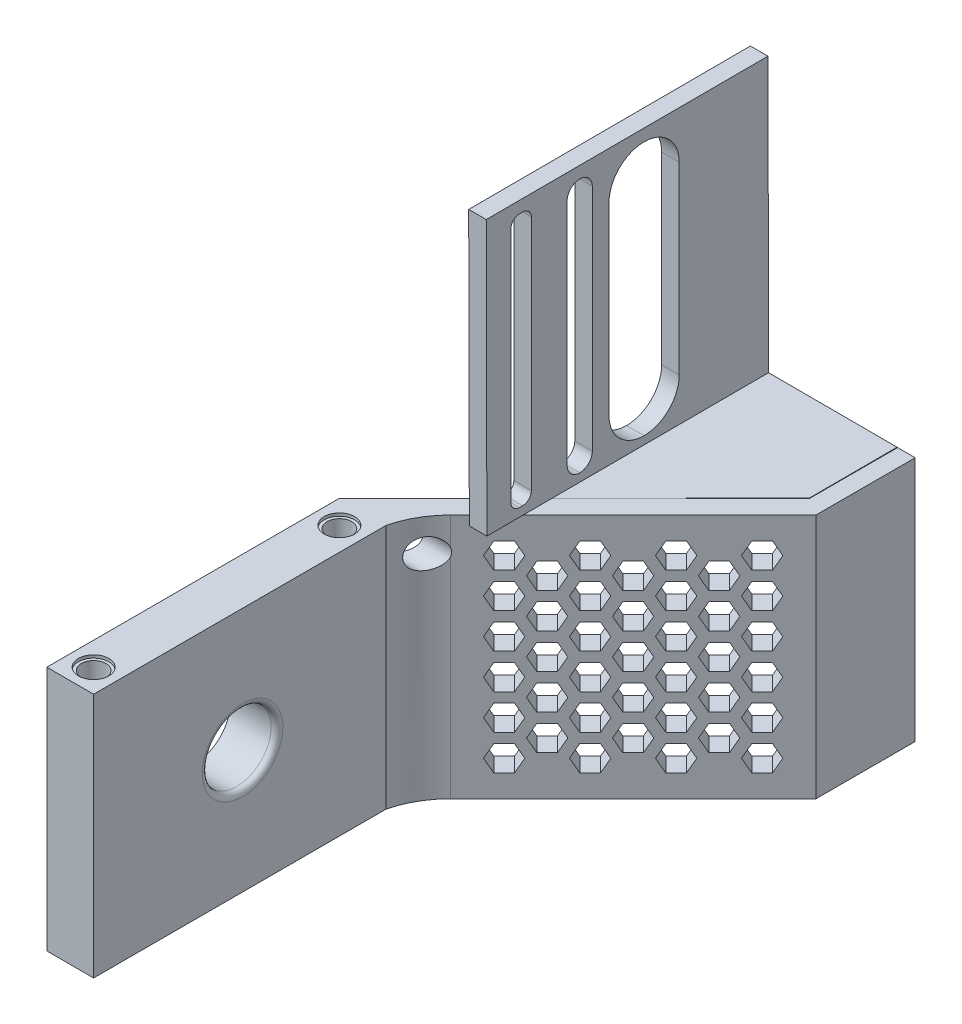
from build123d import *

# Parameters (mm, degrees)
SKETCH1_W           = 25
SKETCH1_H           = 50
SKETCH1_R           = 3.4
BOSS_EXTRUDE1_DEPTH = 3
SKETCH2_W           = 50
SKETCH2_H           = 3
BOSS_EXTRUDE2_DEPTH = 8
SKETCH3_W           = 8
SKETCH3_H           = 50
BOSS_EXTRUDE3_DEPTH = 42
SKETCH4_R           = 2.65
CUT_EXTRUDE1_DEPTH  = 0.5
SKETCH5_R           = 5.888972746
CUT_EXTRUDE2_DEPTH  = 9
FILLET2_R           = 1
SKETCH6_R           = 12.6
BOSS_EXTRUDE4_DEPTH = 2
FILLET4_R           = 1
SKETCH8_R           = 1.589780168
SKETCH8_R_2         = 1.777428262
CUT_EXTRUDE3_DEPTH  = 10
SKETCH9_W           = 49.021678163
SKETCH9_H           = 20.976854622
CUT_EXTRUDE4_DEPTH  = 68.79439129
SKETCH11_R          = 2.1
CUT_EXTRUDE5_DEPTH  = 59.480168703
SKETCH14_R          = 2.6
CUT_EXTRUDE6_DEPTH  = 0.5
BOSS_EXTRUDE5_DEPTH = 42
FILLET5_R           = 15
BOSS_EXTRUDE6_DEPTH = 42
SKETCH17_W          = 48.146702591
SKETCH17_H          = 46.904691646
BOSS_EXTRUDE7_DEPTH = 3
BOSS_EXTRUDE8_DEPTH = 2
FILL_START          = -38.613550417
FILL_PATTERN1_DEPTH = 3.5
SKETCH20_W          = 3.5
SKETCH20_H          = 43.48627111
CUT_EXTRUDE7_DEPTH  = 10
FILLET6_R           = 1.5
SKETCH21_W          = 12
SKETCH21_H          = 43.48627111
CUT_EXTRUDE8_DEPTH  = 10
FILLET7_R           = 6
SKETCH22_R          = 2.5
CUT_EXTRUDE9_DEPTH  = 19
SKETCH23_W          = 4.3
SKETCH23_H          = 43.48627111
CUT_EXTRUDE10_DEPTH = 10
FILLET8_R           = 2.15


# Read off the part's stored shape, not the designer's step: Fill Pattern1
# Some blends are built 0.0001 mm under size
with BuildPart() as part:
    # Sketch1 → Boss-Extrude1 (new body)
    with BuildSketch(Plane(origin=(0, 0, 0), x_dir=(1, 0, 0), z_dir=(0, 1, 0))):
        with Locations((2.276951673, 11.384758364)):
            Rectangle(SKETCH1_W, SKETCH1_H)
        with Locations(Location((1.276951673, 11.384758364, 0), (0, 0, 270))):
            Circle(SKETCH1_R, mode=Mode.SUBTRACT)
    extrude(amount=BOSS_EXTRUDE1_DEPTH)

    # Sketch2 → Boss-Extrude2 (add)
    with BuildSketch(Plane.ZY.offset(10.223048327)):
        with Locations((-11.384758364, 1.5)):
            Rectangle(SKETCH2_W, SKETCH2_H)
    extrude(amount=BOSS_EXTRUDE2_DEPTH)

    # Sketch3 → Boss-Extrude3 (add)
    with BuildSketch(Plane.XZ):
        with Locations((-14.223048327, -11.384758364)):
            Rectangle(SKETCH3_W, SKETCH3_H)
    extrude(amount=BOSS_EXTRUDE3_DEPTH)

    # Sketch4 → Cut-Extrude1 (cut)
    with BuildSketch(Plane(origin=(0, 3, 0), x_dir=(1, 0, 0), z_dir=(0, 1, 0))):
        with Locations(Location((-14.223048327, 32.384758364, 0), (0, 0, 270))):
            Circle(SKETCH4_R)
        with Locations(Location((-14.223048327, -9.615241636, 0), (0, 0, 270))):
            Circle(SKETCH4_R)
    cut_extrude1 = extrude(amount=-CUT_EXTRUDE1_DEPTH, mode=Mode.SUBTRACT)

    # Mirror1: Cut-Extrude1 across plane
    add(cut_extrude1.mirror(Plane.ZX.offset(-19.5)), mode=Mode.SUBTRACT)

    # Sketch5 → Cut-Extrude2 (cut)
    with BuildSketch(Plane.ZY.offset(18.223048327)):
        with Locations((-11.836279124, -21)):
            Circle(SKETCH5_R)
    extrude(amount=-CUT_EXTRUDE2_DEPTH, mode=Mode.SUBTRACT)

    # Fillet2
    fillet2_edges = [part.edges().sort_by_distance(p)[0] for p in [
        (-10.223048327, -21, -17.72525187),
    ]]
    fillet(fillet2_edges, radius=FILLET2_R)

    # Mirror2: Cut-Extrude1 across plane
    add(cut_extrude1.mirror(Plane.ZY.offset(1.723048327)), mode=Mode.SUBTRACT)

    # Sketch6 → Boss-Extrude4 (add)
    with BuildSketch(Plane(origin=(0, 3, 0), x_dir=(1, 0, 0), z_dir=(0, 1, 0))):
        with BuildLine():
            Line((14.776951673, 5.825082115), (14.776951673, 16.944434614))
            ThreePointArc((14.776951673, 16.944434614), (-13.323048327, 11.384758364), (14.776951673, 5.825082115))
        make_face()
        with Locations(Location((1.276951673, 11.384758364, 0), (0, 0, 270))):
            Circle(SKETCH6_R, mode=Mode.SUBTRACT)
    extrude(amount=BOSS_EXTRUDE4_DEPTH)

    # Fillet4
    # the kernel refuses this fillet: 1 mm, written as the material it takes off along each edge
    with BuildSketch(Plane(origin=(14.776951673, 5, -3.325082115), x_dir=(0, -1, 0), z_dir=(0, 0, -1))) as fillet4_piece_1:
        with BuildLine():
            CenterArc((FILLET4_R, FILLET4_R), FILLET4_R, 180, 90)
            Line((0, FILLET4_R), (0, 0))
            Line((0, 0), (FILLET4_R, 0))
        make_face()
    extrude(amount=16.119352499, mode=Mode.SUBTRACT)

    # Sketch8 → Cut-Extrude3 (cut)
    with BuildSketch(Plane(origin=(0, 3, 0), x_dir=(1, 0, 0), z_dir=(0, 1, 0))):
        with Locations(Location((1.276951673, 19.884758364, 0), (0, 0, 270))):
            Circle(SKETCH8_R)
        with Locations(Location((1.276951673, 2.884758364, 0), (0, 0, 270))):
            Circle(SKETCH8_R_2)
    extrude(amount=-CUT_EXTRUDE3_DEPTH, mode=Mode.SUBTRACT)

    # Sketch9 → Cut-Extrude4 (cut, through all)
    with BuildSketch(Plane.XY.offset(13.615241636)):
        with Locations((-9.733887409, 10.488427311)):
            Rectangle(SKETCH9_W, SKETCH9_H)
    extrude(amount=-CUT_EXTRUDE4_DEPTH, mode=Mode.SUBTRACT)

    # Sketch11 → Cut-Extrude5 (cut, through all)
    with BuildSketch(Plane(origin=(0, 0, 0), x_dir=(1, 0, 0), z_dir=(0, 1, 0))):
        with Locations(Location((-14.223048327, 32.384758364, 0), (0, 0, 270))):
            Circle(SKETCH11_R)
    cut_extrude5 = extrude(amount=-CUT_EXTRUDE5_DEPTH, mode=Mode.SUBTRACT)

    # Mirror3: Cut-Extrude5 across plane
    add(cut_extrude5.mirror(Plane.XY.offset(-11.384758364)), mode=Mode.SUBTRACT)

    # Sketch14 → Cut-Extrude6 (cut)
    with BuildSketch(Plane(origin=(0, 0, 0), x_dir=(1, 0, 0), z_dir=(0, 1, 0))):
        with Locations(Location((-14.223048327, -9.615241636, 0), (0, 0, 270))):
            Circle(SKETCH14_R)
    cut_extrude6 = extrude(amount=-CUT_EXTRUDE6_DEPTH, mode=Mode.SUBTRACT)

    # Mirror4: Cut-Extrude6 across plane
    add(cut_extrude6.mirror(Plane.XY.offset(-11.384758364)), mode=Mode.SUBTRACT)

    # Sketch15 → Boss-Extrude5 (add)
    with BuildSketch(Plane(origin=(0, 0, 0), x_dir=(1, 0, 0), z_dir=(0, 1, 0))):
        Polygon((-18.223048327, 36.384758364), (24.976951673, 79.584758364), (24.976951673, 74.635010896), (-13.273300859, 36.384758364), align=None)
    extrude(amount=-BOSS_EXTRUDE5_DEPTH)

    # Fillet5
    # the kernel refuses this fillet: 15 mm, written as the material it adds along each edge
    with BuildSketch(Plane(origin=(-13.273300859, 0, -36.384758364), x_dir=(1, 0, 0), z_dir=(0, -1, 0))) as fillet5_piece_1:
        with BuildLine():
            CenterArc((17.611399837, 3.601803599), FILLET5_R, 193.893637127, 31.106362873)
            Line((7.004798119, -7.004798119), (0, 0))
            Line((0, 0), (3.050252532, 0))
        make_face()
    extrude(amount=42)

    # Sketch16 → Boss-Extrude6 (add)
    with BuildSketch(Plane(origin=(0, 0, 0), x_dir=(1, 0, 0), z_dir=(0, 1, 0))):
        Polygon((21.976951673, 76.584758364), (21.976951673, 91.584758364), (24.976951673, 91.584758364), (24.976951673, 79.584758364), align=None)
    extrude(amount=-BOSS_EXTRUDE6_DEPTH)



with BuildPart() as body_2:
    # Sketch17 → Boss-Extrude7 (new body)
    with BuildSketch(Plane(origin=(-0.023048327, -88.270826713, 236.630045038), x_dir=(0, 0.002303401717977271, -0.999997347166744), z_dir=(1, 0, 0))):
        with Locations((304.295533146, 111.077940737)):
            Rectangle(SKETCH17_W, SKETCH17_H)
    extrude(amount=-BOSS_EXTRUDE7_DEPTH)


with BuildPart() as part_1:
    add(part.part)

    add(body_2.part)  # Boss-Extrude8 merges body 2
    # Sketch18 → Boss-Extrude8 (add)
    with BuildSketch(Plane(origin=(0, -0.099943314, -0.00023021), x_dir=(1, 0, 0), z_dir=(0, -0.9999973471667442, -0.0023034017179773937))):
        Polygon((21.976951673, -91.487772533), (-3.023048327, -91.536143969), (-3.023048327, -51.487878646), (21.976951673, -76.487812326), align=None)
    extrude(amount=BOSS_EXTRUDE8_DEPTH)

    # Fill Pattern1 outline → Fill Pattern1 (cut)
    with BuildSketch(Plane(origin=(0, 0, 0), x_dir=(0.7071067811865457, 0, -0.7071067811865495), z_dir=(0.7071067811865493, 0, 0.7071067811865458)).offset(FILL_START)):
        Polygon((30.253964255, -6), (31.503964255, -8.165063509), (34.003964255, -8.165063509), (35.253964255, -6), (34.003964255, -3.834936491), (31.503964255, -3.834936491), align=None)
        Polygon((45.842421523, -33), (47.092421523, -35.165063509), (49.592421523, -35.165063509), (50.842421523, -33), (49.592421523, -30.834936491), (47.092421523, -30.834936491), align=None)
        Polygon((40.6462691, -24), (41.8962691, -26.165063509), (44.3962691, -26.165063509), (45.6462691, -24), (44.3962691, -21.834936491), (41.8962691, -21.834936491), align=None)
        Polygon((35.450116678, -15), (36.700116678, -17.165063509), (39.200116678, -17.165063509), (40.450116678, -15), (39.200116678, -12.834936491), (36.700116678, -12.834936491), align=None)
        Polygon((52.288573946, -8.165063509), (54.788573946, -8.165063509), (56.038573946, -6), (54.788573946, -3.834936491), (52.288573946, -3.834936491), (51.038573946, -6), align=None)
        Polygon((41.8962691, -8.165063509), (44.3962691, -8.165063509), (45.6462691, -6), (44.3962691, -3.834936491), (41.8962691, -3.834936491), (40.6462691, -6), align=None)
        Polygon((62.680878791, -8.165063509), (65.180878791, -8.165063509), (66.430878791, -6), (65.180878791, -3.834936491), (62.680878791, -3.834936491), (61.430878791, -6), align=None)
        Polygon((30.253964255, -24), (31.503964255, -26.165063509), (34.003964255, -26.165063509), (35.253964255, -24), (34.003964255, -21.834936491), (31.503964255, -21.834936491), align=None)
        Polygon((35.450116678, -33), (36.700116678, -35.165063509), (39.200116678, -35.165063509), (40.450116678, -33), (39.200116678, -30.834936491), (36.700116678, -30.834936491), align=None)
        Polygon((62.680878791, -26.165063509), (65.180878791, -26.165063509), (66.430878791, -24), (65.180878791, -21.834936491), (62.680878791, -21.834936491), (61.430878791, -24), align=None)
        Polygon((52.288573946, -26.165063509), (54.788573946, -26.165063509), (56.038573946, -24), (54.788573946, -21.834936491), (52.288573946, -21.834936491), (51.038573946, -24), align=None)
        Polygon((57.484726369, -35.165063509), (59.984726369, -35.165063509), (61.234726369, -33), (59.984726369, -30.834936491), (57.484726369, -30.834936491), (56.234726369, -33), align=None)
        Polygon((49.592421523, -17.165063509), (50.842421523, -15), (49.592421523, -12.834936491), (47.092421523, -12.834936491), (45.842421523, -15), (47.092421523, -17.165063509), align=None)
        Polygon((35.450116678, -27), (36.700116678, -29.165063509), (39.200116678, -29.165063509), (40.450116678, -27), (39.200116678, -24.834936491), (36.700116678, -24.834936491), align=None)
        Polygon((30.253964255, -18), (31.503964255, -20.165063509), (34.003964255, -20.165063509), (35.253964255, -18), (34.003964255, -15.834936491), (31.503964255, -15.834936491), align=None)
        Polygon((40.6462691, -36), (41.8962691, -38.165063509), (44.3962691, -38.165063509), (45.6462691, -36), (44.3962691, -33.834936491), (41.8962691, -33.834936491), align=None)
        Polygon((57.484726369, -29.165063509), (59.984726369, -29.165063509), (61.234726369, -27), (59.984726369, -24.834936491), (57.484726369, -24.834936491), (56.234726369, -27), align=None)
        Polygon((47.092421523, -29.165063509), (49.592421523, -29.165063509), (50.842421523, -27), (49.592421523, -24.834936491), (47.092421523, -24.834936491), (45.842421523, -27), align=None)
        Polygon((34.003964255, -38.165063509), (35.253964255, -36), (34.003964255, -33.834936491), (31.503964255, -33.834936491), (30.253964255, -36), (31.503964255, -38.165063509), align=None)
        Polygon((49.592421523, -11.165063509), (50.842421523, -9), (49.592421523, -6.834936491), (47.092421523, -6.834936491), (45.842421523, -9), (47.092421523, -11.165063509), align=None)
        Polygon((44.3962691, -20.165063509), (45.6462691, -18), (44.3962691, -15.834936491), (41.8962691, -15.834936491), (40.6462691, -18), (41.8962691, -20.165063509), align=None)
        Polygon((35.450116678, -21), (36.700116678, -23.165063509), (39.200116678, -23.165063509), (40.450116678, -21), (39.200116678, -18.834936491), (36.700116678, -18.834936491), align=None)
        Polygon((30.253964255, -12), (31.503964255, -14.165063509), (34.003964255, -14.165063509), (35.253964255, -12), (34.003964255, -9.834936491), (31.503964255, -9.834936491), align=None)
        Polygon((40.6462691, -30), (41.8962691, -32.165063509), (44.3962691, -32.165063509), (45.6462691, -30), (44.3962691, -27.834936491), (41.8962691, -27.834936491), align=None)
        Polygon((57.484726369, -23.165063509), (59.984726369, -23.165063509), (61.234726369, -21), (59.984726369, -18.834936491), (57.484726369, -18.834936491), (56.234726369, -21), align=None)
        Polygon((47.092421523, -23.165063509), (49.592421523, -23.165063509), (50.842421523, -21), (49.592421523, -18.834936491), (47.092421523, -18.834936491), (45.842421523, -21), align=None)
        Polygon((34.003964255, -32.165063509), (35.253964255, -30), (34.003964255, -27.834936491), (31.503964255, -27.834936491), (30.253964255, -30), (31.503964255, -32.165063509), align=None)
        Polygon((44.3962691, -14.165063509), (45.6462691, -12), (44.3962691, -9.834936491), (41.8962691, -9.834936491), (40.6462691, -12), (41.8962691, -14.165063509), align=None)
        Polygon((62.680878791, -32.165063509), (65.180878791, -32.165063509), (66.430878791, -30), (65.180878791, -27.834936491), (62.680878791, -27.834936491), (61.430878791, -30), align=None)
        Polygon((52.288573946, -32.165063509), (54.788573946, -32.165063509), (56.038573946, -30), (54.788573946, -27.834936491), (52.288573946, -27.834936491), (51.038573946, -30), align=None)
        Polygon((62.680878791, -38.165063509), (65.180878791, -38.165063509), (66.430878791, -36), (65.180878791, -33.834936491), (62.680878791, -33.834936491), (61.430878791, -36), align=None)
        Polygon((52.288573946, -38.165063509), (54.788573946, -38.165063509), (56.038573946, -36), (54.788573946, -33.834936491), (52.288573946, -33.834936491), (51.038573946, -36), align=None)
        Polygon((56.234726369, -15), (57.484726369, -17.165063509), (59.984726369, -17.165063509), (61.234726369, -15), (59.984726369, -12.834936491), (57.484726369, -12.834936491), align=None)
        Polygon((56.234726369, -9), (57.484726369, -11.165063509), (59.984726369, -11.165063509), (61.234726369, -9), (59.984726369, -6.834936491), (57.484726369, -6.834936491), align=None)
        Polygon((61.430878791, -18), (62.680878791, -20.165063509), (65.180878791, -20.165063509), (66.430878791, -18), (65.180878791, -15.834936491), (62.680878791, -15.834936491), align=None)
        Polygon((36.700116678, -11.165063509), (39.200116678, -11.165063509), (40.450116678, -9), (39.200116678, -6.834936491), (36.700116678, -6.834936491), (35.450116678, -9), align=None)
        Polygon((54.788573946, -20.165063509), (56.038573946, -18), (54.788573946, -15.834936491), (52.288573946, -15.834936491), (51.038573946, -18), (52.288573946, -20.165063509), align=None)
        Polygon((62.680878791, -14.165063509), (65.180878791, -14.165063509), (66.430878791, -12), (65.180878791, -9.834936491), (62.680878791, -9.834936491), (61.430878791, -12), align=None)
        Polygon((52.288573946, -14.165063509), (54.788573946, -14.165063509), (56.038573946, -12), (54.788573946, -9.834936491), (52.288573946, -9.834936491), (51.038573946, -12), align=None)
    extrude(amount=FILL_PATTERN1_DEPTH, mode=Mode.SUBTRACT)

    # Sketch20 → Cut-Extrude7 (cut)
    with BuildSketch(Plane(origin=(-0.023048327, 0, 0), x_dir=(0, 0, -1), z_dir=(1, 0, 0))):
        with Locations((49.241327098, 23.171442648)):
            Rectangle(SKETCH20_W, SKETCH20_H)
    extrude(amount=-CUT_EXTRUDE7_DEPTH, mode=Mode.SUBTRACT)

    # Fillet6
    fillet6_edges = [part_1.edges().sort_by_distance(p)[0] for p in [
        (-1.523048327, 1.428307093, -47.491327098),
        (-1.523048327, 44.914578203, -47.491327098),
        (-1.523048327, 44.914578203, -50.991327098),
        (-1.523048327, 1.428307093, -50.991327098),
    ]]
    fillet(fillet6_edges, radius=FILLET6_R)

    # Sketch21 → Cut-Extrude8 (cut)
    with BuildSketch(Plane(origin=(-0.023048327, 0, 0), x_dir=(0, 0, -1), z_dir=(1, 0, 0))):
        with Locations((70.260850303, 23.171442648)):
            Rectangle(SKETCH21_W, SKETCH21_H)
    extrude(amount=-CUT_EXTRUDE8_DEPTH, mode=Mode.SUBTRACT)

    # Fillet7
    fillet7_edges = [part_1.edges().sort_by_distance(p)[0] for p in [
        (-1.523048327, 1.428307093, -76.260850303),
        (-1.523048327, 1.428307093, -64.260850303),
        (-1.523048327, 44.914578203, -64.260850303),
        (-1.523048327, 44.914578203, -76.260850303),
    ]]
    fillet(fillet7_edges, radius=FILLET7_R - 0.0001)  # a hair under: the kernel refuses the full size

    # Sketch22 → Cut-Extrude9 (cut)
    with BuildSketch(Plane(origin=(-0.023048327, -88.270826713, 236.630045038), x_dir=(0, 0.002303401717977271, -0.999997347166744), z_dir=(1, 0, 0))):
        with Locations(Location((277.825361125, 82.131101179, 0), (0, 0, 17.378237416))):
            Circle(SKETCH22_R)
    extrude(amount=-CUT_EXTRUDE9_DEPTH, mode=Mode.SUBTRACT)

    # Sketch23 → Cut-Extrude10 (cut)
    with BuildSketch(Plane(origin=(-0.023048327, 0, 0), x_dir=(0, 0, -1), z_dir=(1, 0, 0))):
        with Locations((59.260879484, 23.171442648)):
            Rectangle(SKETCH23_W, SKETCH23_H)
    extrude(amount=-CUT_EXTRUDE10_DEPTH, mode=Mode.SUBTRACT)

    # Fillet8
    fillet8_edges = [part_1.edges().sort_by_distance(p)[0] for p in [
        (-1.523048327, 1.428307093, -57.110879484),
        (-1.523048327, 1.428307093, -61.410879484),
        (-1.523048327, 44.914578203, -57.110879484),
        (-1.523048327, 44.914578203, -61.410879484),
    ]]
    fillet(fillet8_edges, radius=FILLET8_R - 0.0001)  # a hair under: the kernel refuses the full size


solid = part_1.part
